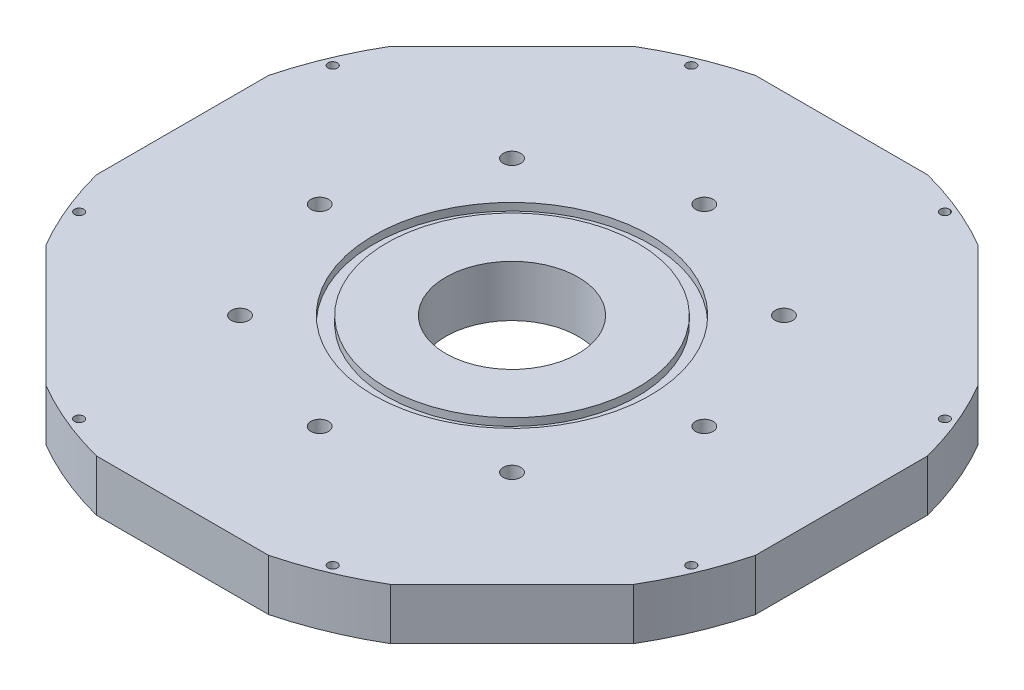
from build123d import *

# Parameters (mm, degrees)
BOSS_EXTRUDE1_DEPTH = 19.05
SKETCH3_R           = 24.5745
CUT_EXTRUDE1_DEPTH  = 175.004260005
SKETCH5_R           = 51.3715
SKETCH5_R_2         = 46.5455
CUT_EXTRUDE2_DEPTH  = 2.794
SKETCH19_R          = 1.7272
CUT_EXTRUDE4_DEPTH  = 175.004260005
CIRPATTERN2_COUNT   = 8
SKETCH37_R          = 119.0625
SKETCH37_R_2        = 115.2525
CUT_EXTRUDE7_DEPTH  = 2.667
CIRPATTERN4_COUNT   = 8


with BuildPart() as part:
    # Sketch1 → Boss-Extrude1 (new body)
    with BuildSketch(Plane(origin=(0, 0, 0), x_dir=(1, 0, 0), z_dir=(0, 1, 0))):
        with BuildLine():
            ThreePointArc((-31.932272077, 122.3), (-48.371185851, 116.778372909), (-63.899633215, 109.058685463))
            Line((-63.899633215, 109.058685463), (-109.058685463, 63.899633215))
            ThreePointArc((-109.058685463, 63.899633215), (-116.778372909, 48.371185851), (-122.3, 31.932272077))
            Line((-122.3, 31.932272077), (-122.3, -31.932272077))
            ThreePointArc((-122.3, -31.932272077), (-116.778372909, -48.371185851), (-109.058685463, -63.899633215))
            Line((-109.058685463, -63.899633215), (-63.899633215, -109.058685463))
            ThreePointArc((-63.899633215, -109.058685463), (-48.371185851, -116.778372909), (-31.932272077, -122.3))
            Line((-31.932272077, -122.3), (31.932272077, -122.3))
            ThreePointArc((31.932272077, -122.3), (48.371185851, -116.778372909), (63.899633215, -109.058685463))
            Line((63.899633215, -109.058685463), (109.058685463, -63.899633215))
            ThreePointArc((109.058685463, -63.899633215), (116.778372909, -48.371185851), (122.3, -31.932272077))
            Line((122.3, -31.932272077), (122.3, 31.932272077))
            ThreePointArc((122.3, 31.932272077), (116.778372909, 48.371185851), (109.058685463, 63.899633215))
            Line((109.058685463, 63.899633215), (63.899633215, 109.058685463))
            ThreePointArc((63.899633215, 109.058685463), (48.371185851, 116.778372909), (31.932272077, 122.3))
            Line((31.932272077, 122.3), (-31.932272077, 122.3))
        make_face()
    extrude(amount=BOSS_EXTRUDE1_DEPTH)

    # Sketch3 → Cut-Extrude1 (cut, through all)
    with BuildSketch(Plane(origin=(0, 19.05, 0), x_dir=(1, 0, 0), z_dir=(0, 1, 0))):
        Circle(SKETCH3_R)
    extrude(amount=-CUT_EXTRUDE1_DEPTH, mode=Mode.SUBTRACT)

    # Sketch5 → Cut-Extrude2 (cut)
    with BuildSketch(Plane(origin=(0, 19.05, 0), x_dir=(1, 0, 0), z_dir=(0, 1, 0))):
        Circle(SKETCH5_R)
        Circle(SKETCH5_R_2, mode=Mode.SUBTRACT)
    extrude(amount=-CUT_EXTRUDE2_DEPTH, mode=Mode.SUBTRACT)

    # Sketch19 → Cut-Extrude4 (cut, through all)
    with BuildSketch(Plane(origin=(0, 19.05, 0), x_dir=(1, 0, 0), z_dir=(0, 1, 0))):
        with Locations((-47.055461432, 113.601933173)):
            Circle(SKETCH19_R)
    cut_extrude4 = extrude(amount=-CUT_EXTRUDE4_DEPTH, mode=Mode.SUBTRACT)

    # CirPattern2: Cut-Extrude4 ×8 about axis
    cirpattern2_axis = Axis((0, 0, 0), (0, 1, 0))
    for i in range(1, CIRPATTERN2_COUNT):
        add(cut_extrude4.rotate(cirpattern2_axis, i * 360 / CIRPATTERN2_COUNT), mode=Mode.SUBTRACT)

    # Sketch23 → 5/16-18 Tapped Hole2 (revolve, cut)
    with BuildSketch(Plane(origin=(-71.374, 19.05, 0), x_dir=(0, 0, 1), z_dir=(1, 0, 0))):
        Polygon((0, 0), (0, 14.661148974), (3.2639, 12.7), (3.2639, 0), align=None)
    f_5_16_18_tapped_hole2 = revolve(axis=Axis((-71.374, 25.4, 0), (0, -1, 0)), mode=Mode.SUBTRACT)

    # Sketch37 → Cut-Extrude7 (cut)
    with BuildSketch(Plane.XZ):
        Circle(SKETCH37_R)
        Circle(SKETCH37_R_2, mode=Mode.SUBTRACT)
    extrude(amount=-CUT_EXTRUDE7_DEPTH, mode=Mode.SUBTRACT)

    # CirPattern4: 5/16-18 Tapped Hole2 ×8 about axis
    cirpattern4_axis = Axis((0, 0, 0), (0, 1, 0))
    for i in range(1, CIRPATTERN4_COUNT):
        add(f_5_16_18_tapped_hole2.rotate(cirpattern4_axis, i * 360 / CIRPATTERN4_COUNT), mode=Mode.SUBTRACT)


solid = part.part
